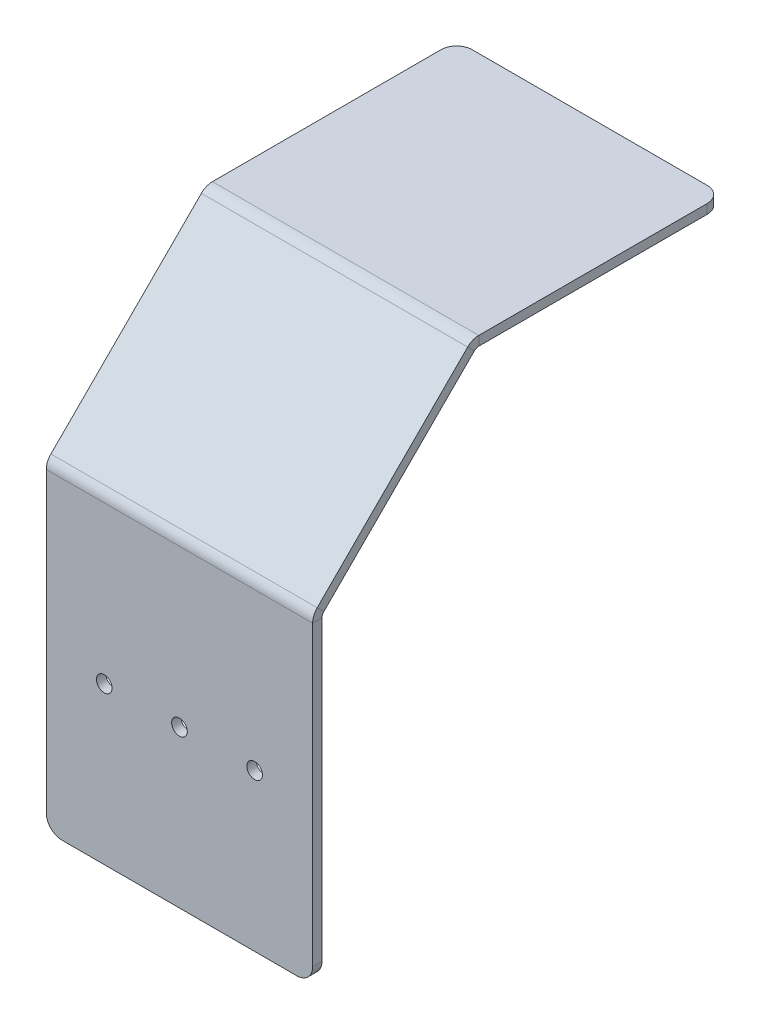
from build123d import *

# Parameters (mm, degrees)
CROQUIS1_W             = 85
CROQUIS1_H             = 100
BRIDA_BASE3_DEPTH      = 3
BRIDA_DE_ARISTA1_DEPTH = 85
CROQUIS21_R            = 2.5
CORTAR_EXTRUIR3_DEPTH  = 35
REDONDEO3_R            = 5
REDONDEO4_R            = 5
BRIDA_DE_ARISTA2_DEPTH = 85
REDONDEO5_R            = 5


# Sheet-metal steps are written as plain solids
with BuildPart() as part:
    # Croquis1 → Brida base3 (new body)
    with BuildSketch(Plane.XY):
        Rectangle(CROQUIS1_W, CROQUIS1_H)
    extrude(amount=-BRIDA_BASE3_DEPTH)

    # Brida de arista1 section (across the edge) → Brida de arista1 (add)
    with BuildSketch(Plane(origin=(-42.5, 50.828427125, -3), x_dir=(0, -0.7071067811865438, -0.7071067811865512), z_dir=(1, 0, 0))):
        with BuildLine():
            Line((-3, 0.828427125), (-3, 68.757359313))
            Line((-3, 68.757359313), (0, 68.757359313))
            Line((0, 68.757359313), (0, 0.828427125))
            ThreePointArc((0, 0.828427125), (0.152240935, 0.06306026), (0.585786438, -0.585786438))
            Line((0.585786438, -0.585786438), (-1.535533906, -2.707106781))
            ThreePointArc((-1.535533906, -2.707106781), (-2.619397663, -1.084990037), (-3, 0.828427125))
        make_face()
    extrude(amount=BRIDA_DE_ARISTA1_DEPTH)

    # Croquis21 → Cortar-Extruir3 (cut)
    with BuildSketch(Plane.XY):
        Circle(CROQUIS21_R)
        with Locations((24, 0)):
            Circle(CROQUIS21_R)
        with Locations((-24, 0)):
            Circle(CROQUIS21_R)
    extrude(amount=-CORTAR_EXTRUIR3_DEPTH, mode=Mode.SUBTRACT)

    # Redondeo3
    redondeo3_edges = [part.edges().sort_by_distance(p)[0] for p in [
        (42.5, -50, -1.5),
    ]]
    fillet(redondeo3_edges, radius=REDONDEO3_R)

    # Redondeo4
    redondeo4_edges = [part.edges().sort_by_distance(p)[0] for p in [
        (-42.5, -50, -1.5),
    ]]
    fillet(redondeo4_edges, radius=REDONDEO4_R)

    # Brida de arista2 section (across the edge) → Brida de arista2 (add)
    with BuildSketch(Plane(origin=(-42.5, 100.033008589, -52.204581464), x_dir=(0, -1, 0), z_dir=(1, 0, 0))):
        with BuildLine():
            Line((-3, 0.828427125), (-3, 78.757359313))
            Line((-3, 78.757359313), (0, 78.757359313))
            Line((0, 78.757359313), (0, 0.828427125))
            ThreePointArc((0, 0.828427125), (0.152240935, 0.06306026), (0.585786438, -0.585786438))
            Line((0.585786438, -0.585786438), (-1.535533906, -2.707106781))
            ThreePointArc((-1.535533906, -2.707106781), (-2.619397663, -1.084990037), (-3, 0.828427125))
        make_face()
    extrude(amount=BRIDA_DE_ARISTA2_DEPTH)

    # Redondeo5
    redondeo5_edges = [part.edges().sort_by_distance(p)[0] for p in [
        (-42.5, 101.533008589, -130.961940777),
        (42.5, 101.533008589, -130.961940777),
    ]]
    fillet(redondeo5_edges, radius=REDONDEO5_R)


solid = part.part
